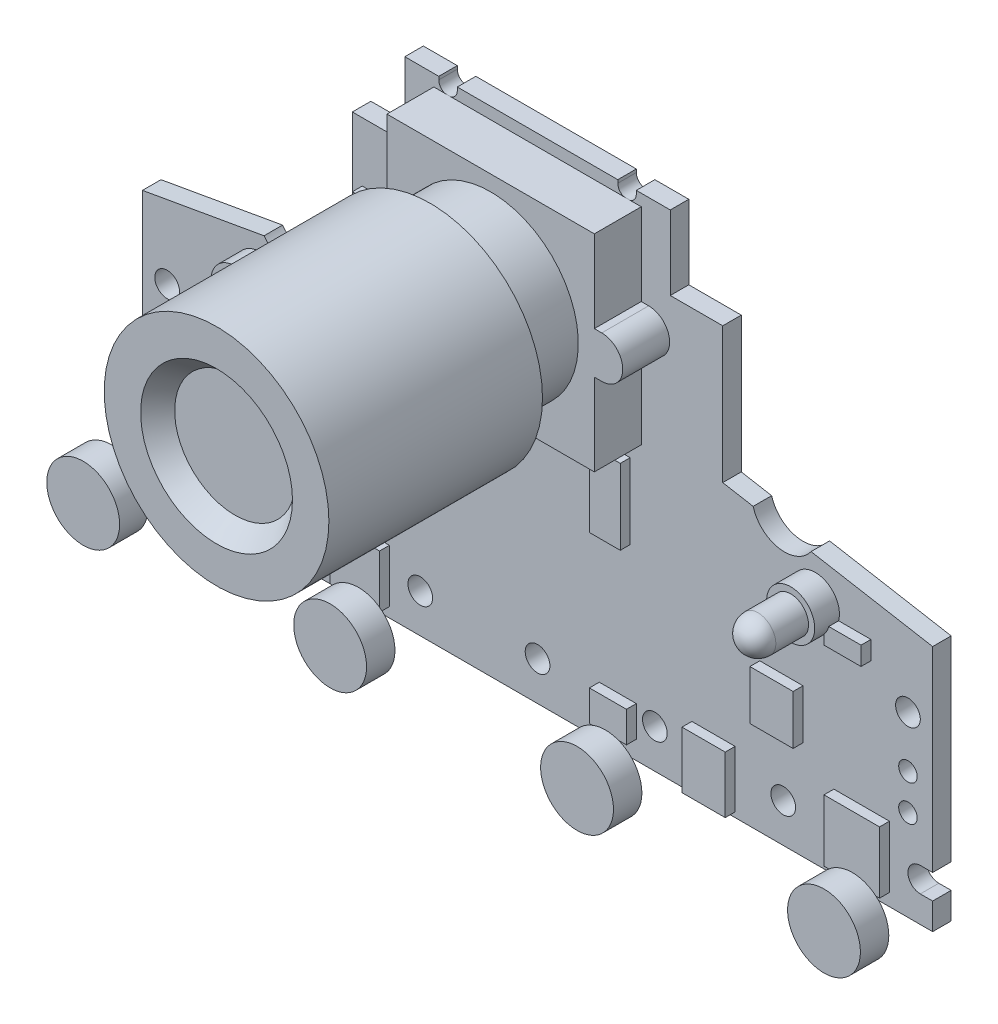
from build123d import *

# Parameters (mm, degrees)
ESQUISSE1_R             = 1
ESQUISSE1_R_2           = 0.75
BOSS_EXTRU_1_DEPTH      = 1.5
ESQUISSE2_W             = 4
ESQUISSE2_H             = 4.3
ESQUISSE2_W_2           = 3
ESQUISSE2_H_2           = 2.5
ESQUISSE2_W_3           = 3.5
ESQUISSE2_H_3           = 4.6
ESQUISSE2_W_4           = 4.5
ESQUISSE2_H_4           = 5
ESQUISSE2_H_5           = 4
ESQUISSE2_W_5           = 2.5
ESQUISSE2_H_6           = 6.1
ESQUISSE2_W_6           = 5
ESQUISSE2_H_7           = 7
ESQUISSE2_W_7           = 7
ESQUISSE2_H_8           = 5.5
ESQUISSE2_H_9           = 6
ESQUISSE2_H_10          = 1.5
BOSS_EXTRU_2_DEPTH      = 0.8
ESQUISSE3_W             = 4
ESQUISSE3_H             = 10
BOSS_EXTRU_3_DEPTH      = 2
ESQUISSE4_R             = 1.95
BOSS_EXTRU_4_DEPTH      = 2
ESQUISSE5_R             = 1.45
BOSS_EXTRU_5_DEPTH      = 4.1
CONG_1_R                = 1.45
CONG_2_R                = 1.45
BOSS_EXTRU_6_START      = 6
BOSS_EXTRU_6_OUTLINE_R  = 2.95
BOSS_EXTRU_6_DEPTH      = 2.3
BOSS_EXTRU_7_DEPTH      = 3.8
ESQUISSE7_R             = 7.1
BOSS_EXTRU_8_DEPTH      = 5.25
ESQUISSE8_R             = 9.1
BOSS_EXTRU_9_DEPTH      = 17.3
ESQUISSE9_R             = 6.15
ENL_V_MAT_EXTRU_1_DEPTH = 1.5
ENL_V_MAT_EXTRU_1_DRAFT = -40


# Read off the part's stored shape, not the designer's step: Boss.-Extru.6
with BuildPart() as part:
    # Esquisse1 → Boss.-Extru.1 (new body)
    with BuildSketch(Plane.XY):
        with BuildLine():
            Line((32, 0), (32, 2.15))
            Line((32, 2.15), (31, 2.15))
            ThreePointArc((31, 2.15), (30, 3.15), (31, 4.15))
            Line((31, 4.15), (32, 4.15))
            Line((32, 4.15), (32, 20))
            Line((32, 20), (22.152164412, 21.737853339))
            ThreePointArc((22.152164412, 21.737853339), (19.546358249, 20.674375706), (17.461958897, 22.565536665))
            Line((17.461958897, 22.565536665), (15, 23))
            Line((15, 23), (15, 34))
            Line((15, 34), (10.75, 34))
            Line((10.75, 34), (10.75, 40))
            Line((10.75, 40), (8, 40))
            Line((8, 40), (8, 39.75))
            ThreePointArc((8, 39.75), (7.25, 39), (6.5, 39.75))
            Line((6.5, 39.75), (6.5, 40))
            Line((6.5, 40), (-6.5, 40))
            Line((-6.5, 40), (-6.5, 39.75))
            ThreePointArc((-6.5, 39.75), (-7.25, 39), (-8, 39.75))
            Line((-8, 39.75), (-8, 40))
            Line((-8, 40), (-10.75, 40))
            Line((-10.75, 40), (-10.75, 34))
            Line((-10.75, 34), (-15, 34))
            Line((-15, 34), (-15, 23))
            Line((-15, 23), (-17.461958897, 22.565536665))
            ThreePointArc((-17.461958897, 22.565536665), (-19.546358249, 20.674375706), (-22.152164412, 21.737853339))
            Line((-22.152164412, 21.737853339), (-32, 20))
            Line((-32, 20), (-32, 4.15))
            Line((-32, 4.15), (-31, 4.15))
            ThreePointArc((-31, 4.15), (-30, 3.15), (-31, 2.15))
            Line((-31, 2.15), (-32, 2.15))
            Line((-32, 2.15), (-32, 0))
            Line((-32, 0), (32, 0))
        make_face()
        with Locations((-19.9, 3.15)):
            Circle(ESQUISSE1_R, mode=Mode.SUBTRACT)
        with Locations((-9.5, 3.15)):
            Circle(ESQUISSE1_R, mode=Mode.SUBTRACT)
        with Locations((0, 3.15)):
            Circle(ESQUISSE1_R, mode=Mode.SUBTRACT)
        with Locations((-30, 14.4)):
            Circle(ESQUISSE1_R, mode=Mode.SUBTRACT)
        with Locations((-30, 10.25)):
            Circle(ESQUISSE1_R_2, mode=Mode.SUBTRACT)
        with Locations((-30, 7.35)):
            Circle(ESQUISSE1_R_2, mode=Mode.SUBTRACT)
        with Locations((-9, 30.7)):
            Circle(ESQUISSE1_R, mode=Mode.SUBTRACT)
        with Locations(Location((30, 7.35, 0), (0, 0, 180))):
            Circle(ESQUISSE1_R_2, mode=Mode.SUBTRACT)
        with Locations(Location((30, 10.25, 0), (0, 0, 180))):
            Circle(ESQUISSE1_R_2, mode=Mode.SUBTRACT)
        with Locations(Location((30, 14.4, 0), (0, 0, 180))):
            Circle(ESQUISSE1_R, mode=Mode.SUBTRACT)
        with Locations(Location((9.5, 3.15, 0), (0, 0, 180))):
            Circle(ESQUISSE1_R, mode=Mode.SUBTRACT)
        with Locations(Location((19.9, 3.15, 0), (0, 0, 180))):
            Circle(ESQUISSE1_R, mode=Mode.SUBTRACT)
        with Locations(Location((9, 30.7, 0), (0, 0, 180))):
            Circle(ESQUISSE1_R, mode=Mode.SUBTRACT)
    extrude(amount=BOSS_EXTRU_1_DEPTH)

    # Esquisse2 → Boss.-Extru.2 (add)
    with BuildSketch(Plane.XY.offset(1.5)):
        with Locations((-27, 2.55)):
            Rectangle(ESQUISSE2_W, ESQUISSE2_H)
        with Locations((-14, 2.95)):
            Rectangle(ESQUISSE2_W, ESQUISSE2_H)
        with Locations((6.5, 2.75)):
            Rectangle(ESQUISSE2_W_2, ESQUISSE2_H_2)
        with Locations((14.25, 2.7)):
            Rectangle(ESQUISSE2_W_3, ESQUISSE2_H_3)
        with Locations((26.25, 3.5)):
            Rectangle(ESQUISSE2_W_4, ESQUISSE2_H_4)
        with Locations((19.75, 10)):
            Rectangle(ESQUISSE2_W_3, ESQUISSE2_H_5)
        with Locations((6.25, 17.95)):
            Rectangle(ESQUISSE2_W_5, ESQUISSE2_H_6)
        with Locations((-6.5, 18)):
            Rectangle(ESQUISSE2_W_6, ESQUISSE2_H_7)
        with Locations((-21.5, 11.25)):
            Rectangle(ESQUISSE2_W_7, ESQUISSE2_H_8)
        with Locations((-11.7, 26.2)):
            Rectangle(ESQUISSE2_W_6, ESQUISSE2_H_9)
        with Locations((25.5, 17.25)):
            Rectangle(ESQUISSE2_W_2, ESQUISSE2_H_10)
    extrude(amount=BOSS_EXTRU_2_DEPTH)

    # Esquisse3 → Boss.-Extru.3 (add)
    with BuildSketch(Plane.XY.offset(1.5)):
        with Locations((-11.5, 15)):
            Rectangle(ESQUISSE3_W, ESQUISSE3_H)
    extrude(amount=BOSS_EXTRU_3_DEPTH)

    # Esquisse4 → Boss.-Extru.4 (add)
    with BuildSketch(Plane.XY.offset(1.5)):
        with Locations((-22.5, 18.5)):
            Circle(ESQUISSE4_R)
        with Locations(Location((22.5, 18.5, 0), (0, 0, 320.284862768))):
            Circle(ESQUISSE4_R)
    extrude(amount=BOSS_EXTRU_4_DEPTH)

    # Esquisse5 → Boss.-Extru.5 (add)
    with BuildSketch(Plane.XY.offset(3.5)):
        with Locations((-22.5, 18.5)):
            Circle(ESQUISSE5_R)
        with Locations((22.5, 18.5)):
            Circle(ESQUISSE5_R)
    extrude(amount=BOSS_EXTRU_5_DEPTH)

    # Congé1
    cong_1_edges = [part.edges().sort_by_distance(p)[0] for p in [
        (-23.95, 18.5, 7.6),
    ]]
    fillet(cong_1_edges, radius=CONG_1_R)

    # Congé2
    cong_2_edges = [part.edges().sort_by_distance(p)[0] for p in [
        (21.05, 18.5, 7.6),
    ]]
    fillet(cong_2_edges, radius=CONG_2_R)

    # Esquisse6 → Boss.-Extru.7 (add)
    with BuildSketch(Plane.XY.offset(1.5)):
        with BuildLine():
            Line((-8.999999963, 32.4), (-8.399999968, 32.4))
            Line((-8.399999968, 32.4), (-8.399999968, 39.05))
            Line((-8.399999968, 39.05), (8.400000032, 39.05))
            Line((8.400000032, 39.05), (8.400000032, 32.4))
            Line((8.400000032, 32.4), (9.000000027, 32.4))
            ThreePointArc((9.000000027, 32.4), (10.7, 30.699999987), (9, 29))
            Line((9, 29), (8.400000005, 29))
            Line((8.400000005, 29), (8.400000005, 22.35))
            Line((8.400000005, 22.35), (-8.399999995, 22.35))
            Line((-8.399999995, 22.35), (-8.399999995, 29))
            Line((-8.399999995, 29), (-8.999999989, 29))
            ThreePointArc((-8.999999989, 29), (-10.7, 30.700000013), (-8.999999963, 32.4))
        make_face()
    extrude(amount=BOSS_EXTRU_7_DEPTH)

    # Esquisse7 → Boss.-Extru.8 (add)
    with BuildSketch(Plane.XY.offset(5.3)):
        with Locations(Location((3.2e-08, 30.7, 0), (0, 0, 180))):
            Circle(ESQUISSE7_R)
    extrude(amount=BOSS_EXTRU_8_DEPTH)

    # Esquisse8 → Boss.-Extru.9 (add)
    with BuildSketch(Plane.XY.offset(10.55)):
        with Locations((0.350717787, 30.7)):
            Circle(ESQUISSE8_R)
    extrude(amount=BOSS_EXTRU_9_DEPTH)


with BuildPart() as body_2:
    # Boss.-Extru.6 outline → Boss.-Extru.6 (new body)
    with BuildSketch(Plane.XY.offset(BOSS_EXTRU_6_START)):
        with Locations((30, 2.45)):
            Circle(BOSS_EXTRU_6_OUTLINE_R)
        with Locations((10, 2.45)):
            Circle(BOSS_EXTRU_6_OUTLINE_R)
        with Locations((-10, 2.45)):
            Circle(BOSS_EXTRU_6_OUTLINE_R)
        with Locations((-30, 2.45)):
            Circle(BOSS_EXTRU_6_OUTLINE_R)
    extrude(amount=BOSS_EXTRU_6_DEPTH)


with BuildPart() as enl_v_mat_extru_1_tool:
    # Esquisse9 → Enlèv. mat.-Extru.1 (with draft: the straight prism first)
    with BuildSketch(Plane.XY.offset(27.85)):
        with Locations((0.350717787, 30.7)):
            Circle(ESQUISSE9_R)
    extrude(amount=-ENL_V_MAT_EXTRU_1_DEPTH)
    # Enlèv. mat.-Extru.1: the draft: its side faces are tilted about the plane it starts from
    enl_v_mat_extru_1_sides = [enl_v_mat_extru_1_tool.faces().sort_by_distance(p)[0] for p in [
        (-5.799282213, 30.7, 27.1),
    ]]
    draft(enl_v_mat_extru_1_sides, Plane.XY.offset(27.85), ENL_V_MAT_EXTRU_1_DRAFT)


with BuildPart() as part_1:
    add(part.part)

    # Enlèv. mat.-Extru.1: cut by enl_v_mat_extru_1_tool
    add(enl_v_mat_extru_1_tool.part, mode=Mode.SUBTRACT)


solid = Compound([body_2.part, part_1.part])
